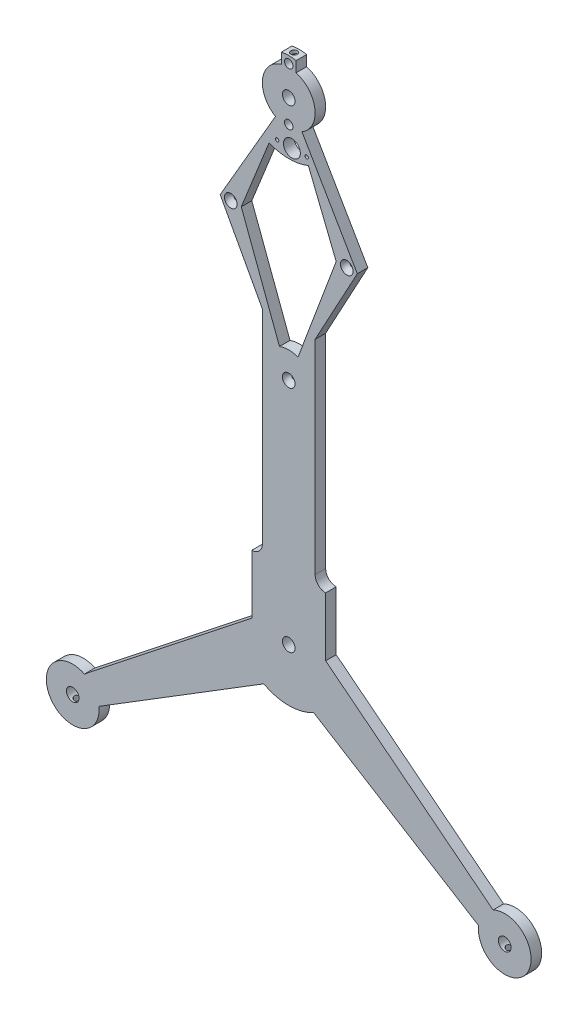
from build123d import *

# Parameters (mm, degrees)
BOSS_EXTRUDE1_DEPTH       = 5
BOSS_EXTRUDE2_DEPTH       = 5
FILLET2_R                 = 5
SKETCH2_R                 = 3
CUT_EXTRUDE1_DEPTH        = 225.405408442
SKETCH4_R                 = 3
CUT_EXTRUDE2_DEPTH        = 225.405408442
SKETCH5_R                 = 1.25
CUT_EXTRUDE3_DEPTH        = 225.405408442
SKETCH8_R                 = 1.25
CUT_EXTRUDE4_DEPTH        = 225.405408442
BOSS_EXTRUDE3_DEPTH       = 5
SKETCH15_R                = 2
CUT_EXTRUDE8_DEPTH        = 225.405408442
SKETCH17_R                = 1.5
CUT_EXTRUDE9_DEPTH        = 3
SKETCH19_R                = 4
CUT_EXTRUDE11_DEPTH       = 225.405408444
M2X0_4_TAPPED_HOLE2_D     = 1.6
M4X0_7_TAPPED_HOLE1_D     = 3.3
M4X0_7_TAPPED_HOLE1_DEPTH = 11.5
M4X0_7_TAPPED_HOLE1_TIP   = 0.991420021


with BuildPart() as part:
    # Sketch1 → Boss-Extrude1 (new body)
    with BuildSketch(Plane.XY):
        with BuildLine():
            Line((-12.5, 0), (-12.5, -78.5))
            Line((-12.5, -78.5), (-17.5, -78.5))
            Line((-17.5, -78.5), (-17.5, -106.384985834))
            Line((-17.5, -106.384985834), (-96.852760713, -168.992385615))
            ThreePointArc((-96.852760713, -168.992385615), (-112.63340609, -187.366759998), (-89.969843477, -178.822210146))
            Line((-89.969843477, -178.822210146), (-11.841670305, -130.517603057))
            ThreePointArc((-11.841670305, -130.517603057), (-6.105731879, -132.742937904), (0, -133.5))
            Line((0, -133.5), (0, -108.5))
            Line((0, -108.5), (0, 0))
            Line((0, 0), (0, 12.5))
            ThreePointArc((0, 12.5), (-8.838834765, 8.838834765), (-12.5, 0))
        make_face()
    extrude(amount=BOSS_EXTRUDE1_DEPTH)

    # Sketch3 → Boss-Extrude2 (add)
    with BuildSketch(Plane.XY):
        with BuildLine():
            Line((-22.5, 59.99791663), (0, 0))
            Line((0, 0), (-12.5, 0))
            Line((-12.5, 0), (-12.5, 23.076121781))
            Line((-12.5, 23.076121781), (-32.5, 59.99791663))
            Line((-32.5, 59.99791663), (-6.274365114, 105.186702896))
            ThreePointArc((-6.274365114, 105.186702896), (-12.070421941, 119.246749368), (0, 128.49791663))
            Line((0, 128.49791663), (0, 115.99791663))
            Line((0, 115.99791663), (0, 90.99791663))
            ThreePointArc((0, 90.99791663), (-4.74657039, 91.452650905), (-9.320466521, 92.800311068))
            Line((-9.320466521, 92.800311068), (-22.5, 59.99791663))
        make_face()
    extrude(amount=BOSS_EXTRUDE2_DEPTH)

    # Fillet2
    fillet2_edges = [part.edges().sort_by_distance(p)[0] for p in [
        (-12.5, -78.5, 2.5),
    ]]
    fillet(fillet2_edges, radius=FILLET2_R - 0.0001)  # a hair under: the kernel refuses the full size

    # Mirror1: part across plane


with BuildPart() as part_1:
    add(part.part)
    add(part.part.mirror(Plane(origin=(0, -133.5, 5), x_dir=(0, 0, 1), z_dir=(-1, 0, 0))))

    # Sketch2 → Cut-Extrude1 (cut, through all)
    with BuildSketch(Plane.XY.offset(5)):
        with Locations((0, -108.5)):
            Circle(SKETCH2_R)
    extrude(amount=-CUT_EXTRUDE1_DEPTH, mode=Mode.SUBTRACT)

    # Sketch4 → Cut-Extrude2 (cut, through all)
    with BuildSketch(Plane.XY.offset(5)):
        with Locations((-102.394005536, -180.197054544)):
            Circle(SKETCH4_R)
        with Locations((102.394005536, -180.197054544)):
            Circle(SKETCH4_R)
        with Locations((0, 115.99791663)):
            Circle(SKETCH4_R)
    extrude(amount=-CUT_EXTRUDE2_DEPTH, mode=Mode.SUBTRACT)

    # Sketch5 → Cut-Extrude3 (cut, through all)
    with BuildSketch(Plane.XY.offset(5)):
        Circle(SKETCH5_R)
    extrude(amount=-CUT_EXTRUDE3_DEPTH, mode=Mode.SUBTRACT)

    # Sketch7 → Cut-Revolve2 (revolve, cut)
    with BuildSketch(Plane(origin=(0, 0, 0), x_dir=(0, 0, -1), z_dir=(1, 0, 0)), mode=Mode.PRIVATE) as cut_revolve2_sk:
        with BuildLine():
            Line((-5, 0), (-2, 0))
            ThreePointArc((-2, 0), (-2.878679656, -2.121320344), (-5, -3))
            Line((-5, -3), (-5, 0))
        make_face()
    cut_revolve2 = revolve(cut_revolve2_sk.sketch.rotate(Axis((0, 0, 5), (0, 0, -1)), 270), axis=Axis((0, 0, 5), (0, 0, -1)), mode=Mode.SUBTRACT)

    # Sketch8 → Cut-Extrude4 (cut, through all)
    with BuildSketch(Plane(origin=(0, 0, 0), x_dir=(-1, 0, 0), z_dir=(0, 0, -1))):
        with Locations((-27.5, 59.99791663)):
            Circle(SKETCH8_R)
        with Locations((27.5, 59.99791663)):
            Circle(SKETCH8_R)
    extrude(amount=-CUT_EXTRUDE4_DEPTH, mode=Mode.SUBTRACT)

    # Sketch14 → Boss-Extrude3 (add)
    with BuildSketch(Plane.XY.offset(5)):
        with BuildLine():
            Line((-3.5, 127.99791663), (3.5, 127.99791663))
            Line((3.5, 127.99791663), (3.5, 132.99791663))
            ThreePointArc((3.5, 132.99791663), (0, 133.354471588), (-3.5, 132.99791663))
            Line((-3.5, 132.99791663), (-3.5, 127.99791663))
        make_face()
    extrude(amount=-BOSS_EXTRUDE3_DEPTH)

    # Sketch15 → Cut-Extrude8 (cut, through all)
    with BuildSketch(Plane.XY.offset(5)):
        with Locations((0, 104.99791663)):
            Circle(SKETCH15_R)
        with Locations((0, 129.99791663)):
            Circle(SKETCH15_R)
    extrude(amount=-CUT_EXTRUDE8_DEPTH, mode=Mode.SUBTRACT)

    # Sketch17 → Cut-Extrude9 (cut)
    with BuildSketch(Plane(origin=(0, 133.354471588, 0), x_dir=(1, 0, 0), z_dir=(0, 1, 0))):
        with Locations(Location((0, -2.5, 0), (0, 0, 270))):
            Circle(SKETCH17_R)
    extrude(amount=-CUT_EXTRUDE9_DEPTH, mode=Mode.SUBTRACT)

    # Sketch19 → Cut-Extrude11 (cut, through all)
    with BuildSketch(Plane.XY.offset(5)):
        with Locations((1.5, 95.99791663)):
            Circle(SKETCH19_R)
    extrude(amount=-CUT_EXTRUDE11_DEPTH, mode=Mode.SUBTRACT)

    # M2x0.4 Tapped Hole2 (through all)
    with Locations(Plane(origin=(0, 0, 0), x_dir=(1, 0, 0), z_dir=(0, 0, -1))):
        with Locations((8.5, -95.99791663), (-5.5, -95.99791663)):
            Hole(M2X0_4_TAPPED_HOLE2_D / 2)

    # Sketch-Pattern1: Cut-Revolve2 at 2 more places
    with Locations((27.5, 59.997917, 0), (-27.5, 59.997917, 0)):
        add(cut_revolve2, mode=Mode.SUBTRACT)

    # M4x0.7 Tapped Hole1
    with Locations(Plane.XZ.offset(192.697054544)):
        with Locations((102.394005536, 2.5), (-102.394005536, 2.5)):
            Hole(M4X0_7_TAPPED_HOLE1_D / 2, depth=M4X0_7_TAPPED_HOLE1_DEPTH)
            with Locations((0, 0, -(M4X0_7_TAPPED_HOLE1_DEPTH + M4X0_7_TAPPED_HOLE1_TIP / 2))):  # 118° drill point
                Cone(0, M4X0_7_TAPPED_HOLE1_D / 2, M4X0_7_TAPPED_HOLE1_TIP, mode=Mode.SUBTRACT)


solid = part_1.part
